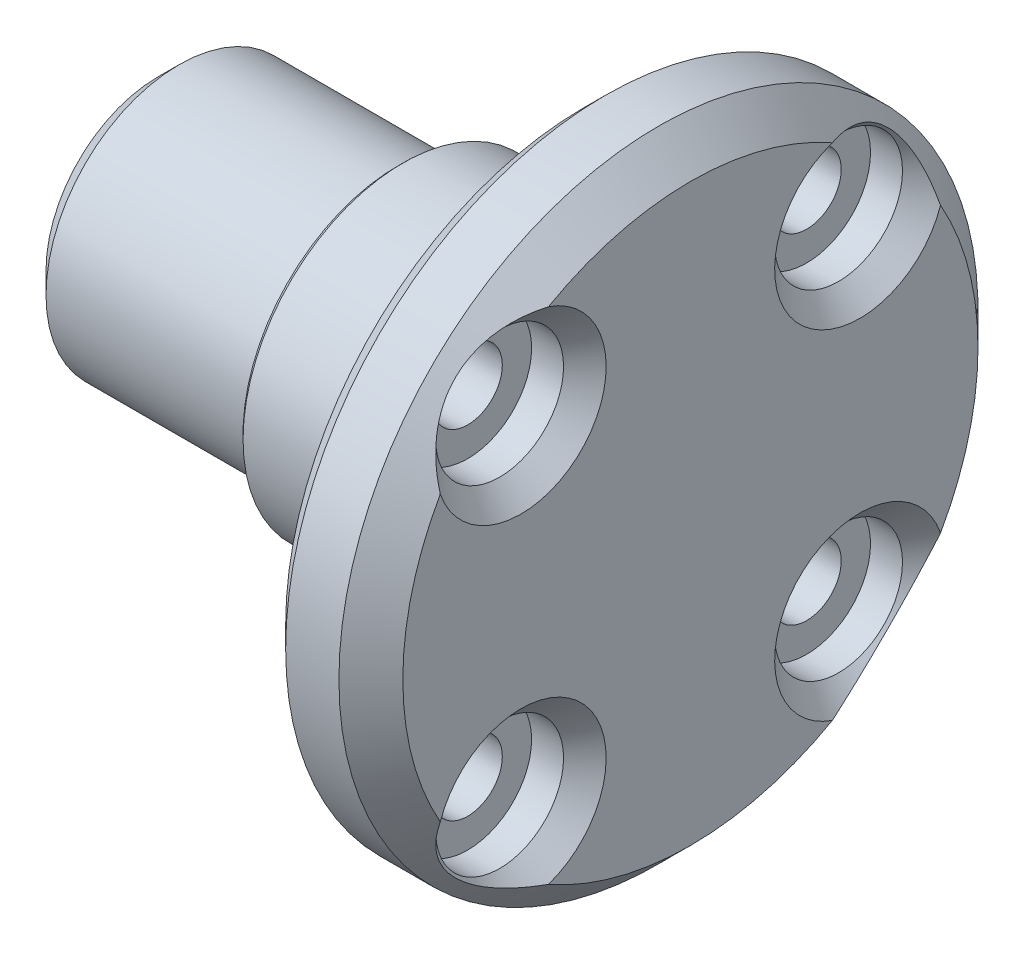
from build123d import *

# Parameters (mm, degrees)
CHAMFER1_SIZE     = 2
FILLET1_R         = 1
CHAMFER2_SIZE     = 0.5
FILLET2_R         = 1
CHAMFER3_SIZE     = 2
CHAMFER4_SIZE     = 3
HOLE1_D           = 6.5
HOLE1_CBORE_D     = 12
HOLE1_CBORE_DEPTH = 5
CIRPATTERN1_COUNT = 4


with BuildPart() as part:
    # Sketch1 → Revolve1 (revolve)
    with BuildSketch(Plane.XY, mode=Mode.PRIVATE) as revolve1_sk:
        Polygon((-40, 0), (-40, 12.5), (-17.5, 12.5), (-17.5, 15), (0, 15), (0, 30), (10, 30), (10, 0), align=None)
    revolve(revolve1_sk.sketch.rotate(Axis((-40, 0, 0), (1, 0, 0)), 90), axis=Axis((-40, 0, 0), (1, 0, 0)))

    # Chamfer1
    chamfer1_edges = [part.edges().sort_by_distance(p)[0] for p in [
        (-40, 0, -12.5),
    ]]
    chamfer(chamfer1_edges, length=CHAMFER1_SIZE)

    # Fillet1
    fillet1_edges = [part.edges().sort_by_distance(p)[0] for p in [
        (-17.5, 0, -12.5),
    ]]
    fillet(fillet1_edges, radius=FILLET1_R)

    # Chamfer2
    chamfer2_edges = [part.edges().sort_by_distance(p)[0] for p in [
        (-17.5, 0, -15),
    ]]
    chamfer(chamfer2_edges, length=CHAMFER2_SIZE)

    # Fillet2
    fillet2_edges = [part.edges().sort_by_distance(p)[0] for p in [
        (0, 0, -15),
    ]]
    fillet(fillet2_edges, radius=FILLET2_R)

    # Chamfer3
    chamfer3_edges = [part.edges().sort_by_distance(p)[0] for p in [
        (0, 0, -30),
    ]]
    chamfer(chamfer3_edges, length=CHAMFER3_SIZE)

    # Chamfer4
    chamfer4_edges = [part.edges().sort_by_distance(p)[0] for p in [
        (10, 0, -30),
    ]]
    chamfer(chamfer4_edges, length=CHAMFER4_SIZE)

    # Hole1 (through all)
    with Locations(Plane(origin=(10, 0, 0), x_dir=(0, 0, -1), z_dir=(1, 0, 0))):
        with Locations((15.909902577, 15.909902577)):
            hole1 = CounterBoreHole(HOLE1_D / 2, HOLE1_CBORE_D / 2, HOLE1_CBORE_DEPTH)

    # CirPattern1: Hole1 ×4 about axis
    cirpattern1_axis = Axis((0, 0, 0), (1, 0, 0))
    for i in range(1, CIRPATTERN1_COUNT):
        add(hole1.rotate(cirpattern1_axis, i * 360 / CIRPATTERN1_COUNT), mode=Mode.SUBTRACT)

    # Chamfer5: read off the stored shape, not the designer's step
    # Chamfer5: loft between two sections, ruled curve by curve
    chamfer5_from = [
        Edge.make_three_point_arc((8, -21.588647326, 13.972931211), (8, -13.972931211, 10.231157827), (8, -10.231157827, 17.846873942)),
        Edge.make_three_point_arc((8, -10.231157827, 17.846873942), (8, -17.846873942, 21.588647326), (8, -21.588647326, 13.972931211)),
    ]
    chamfer5_to = [
        Edge.make_three_point_arc((10.000000095, -23.481562332, 13.327274059), (10.000000095, -13.327274059, 8.338242821), (10.000000095, -8.338242821, 18.492531095)),
        Edge.make_three_point_arc((10.000000095, -8.338242821, 18.492531095), (10.000000095, -18.492531095, 23.481562332), (10.000000095, -23.481562332, 13.327274059)),
    ]
    chamfer5 = Solid(Shell([*[Face.make_surface_from_curves(chamfer5_from[k], chamfer5_to[k]) for k in range(2)], Face(Wire(chamfer5_from)), Face(Wire(chamfer5_to))]))
    add(chamfer5, mode=Mode.SUBTRACT)

    # Chamfer5 2: loft between two sections, ruled curve by curve
    chamfer5_2_from = [
        Edge.make_three_point_arc((8, -13.972931211, -21.588647326), (8, -10.231157827, -13.972931211), (8, -17.846873942, -10.231157827)),
        Edge.make_three_point_arc((8, -17.846873942, -10.231157827), (8, -21.588647326, -17.846873942), (8, -13.972931211, -21.588647326)),
    ]
    chamfer5_2_to = [
        Edge.make_three_point_arc((10.000000095, -13.327274059, -23.481562332), (10.000000095, -8.338242821, -13.327274059), (10.000000095, -18.492531095, -8.338242821)),
        Edge.make_three_point_arc((10.000000095, -18.492531095, -8.338242821), (10.000000095, -23.481562332, -18.492531095), (10.000000095, -13.327274059, -23.481562332)),
    ]
    chamfer5_2 = Solid(Shell([*[Face.make_surface_from_curves(chamfer5_2_from[k], chamfer5_2_to[k]) for k in range(2)], Face(Wire(chamfer5_2_from)), Face(Wire(chamfer5_2_to))]))
    add(chamfer5_2, mode=Mode.SUBTRACT)

    # Chamfer5 3: loft between two sections, ruled curve by curve
    chamfer5_3_from = [
        Edge.make_three_point_arc((8, 21.588647326, -13.972931211), (8, 13.972931211, -10.231157827), (8, 10.231157827, -17.846873942)),
        Edge.make_three_point_arc((8, 10.231157827, -17.846873942), (8, 17.846873942, -21.588647326), (8, 21.588647326, -13.972931211)),
    ]
    chamfer5_3_to = [
        Edge.make_three_point_arc((10.000000095, 23.481562332, -13.327274059), (10.000000095, 13.327274059, -8.338242821), (10.000000095, 8.338242821, -18.492531095)),
        Edge.make_three_point_arc((10.000000095, 8.338242821, -18.492531095), (10.000000095, 18.492531095, -23.481562332), (10.000000095, 23.481562332, -13.327274059)),
    ]
    chamfer5_3 = Solid(Shell([*[Face.make_surface_from_curves(chamfer5_3_from[k], chamfer5_3_to[k]) for k in range(2)], Face(Wire(chamfer5_3_from)), Face(Wire(chamfer5_3_to))]))
    add(chamfer5_3, mode=Mode.SUBTRACT)

    # Chamfer5 4: loft between two sections, ruled curve by curve
    chamfer5_4_from = [
        Edge.make_three_point_arc((8, 13.972931211, 21.588647326), (8, 10.231157827, 13.972931211), (8, 17.846873942, 10.231157827)),
        Edge.make_three_point_arc((8, 17.846873942, 10.231157827), (8, 21.588647326, 17.846873942), (8, 13.972931211, 21.588647326)),
    ]
    chamfer5_4_to = [
        Edge.make_three_point_arc((10.000000095, 13.327274059, 23.481562332), (10.000000095, 8.338242821, 13.327274059), (10.000000095, 18.492531095, 8.338242821)),
        Edge.make_three_point_arc((10.000000095, 18.492531095, 8.338242821), (10.000000095, 23.481562332, 18.492531095), (10.000000095, 13.327274059, 23.481562332)),
    ]
    chamfer5_4 = Solid(Shell([*[Face.make_surface_from_curves(chamfer5_4_from[k], chamfer5_4_to[k]) for k in range(2)], Face(Wire(chamfer5_4_from)), Face(Wire(chamfer5_4_to))]))
    add(chamfer5_4, mode=Mode.SUBTRACT)


solid = part.part
